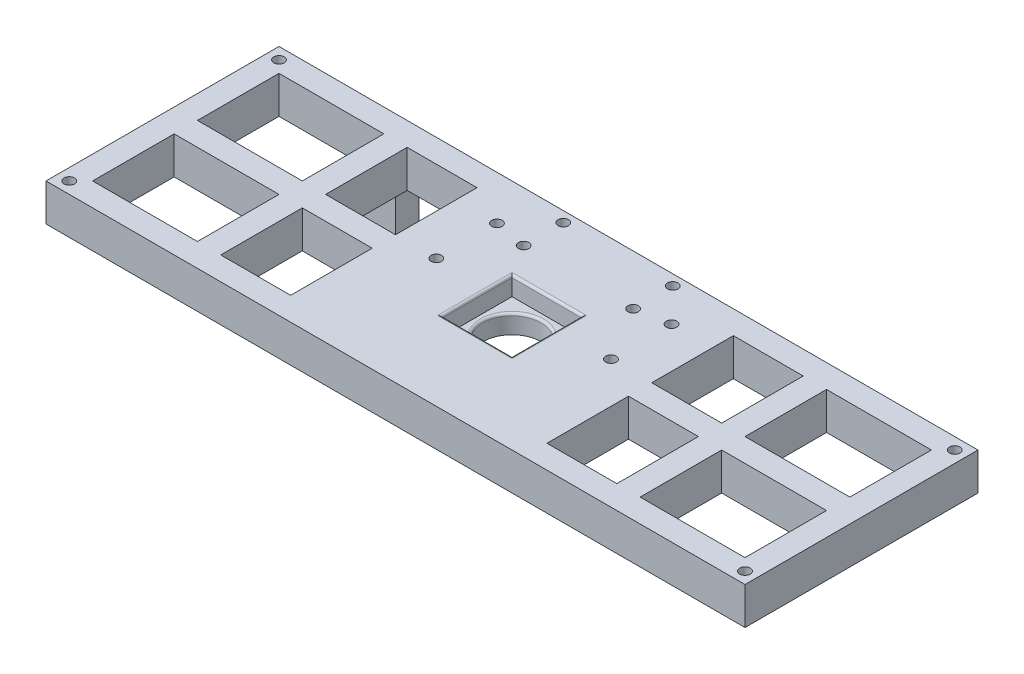
from build123d import *

# Parameters (mm, degrees)
SKETCH_1_W           = 300
SKETCH_1_H           = 100
EXTRUDE_1_DEPTH      = 16
SKETCH_2_W           = 30
SKETCH_2_H           = 30
CUT_EXTRUDE_1_DEPTH  = 8
SKETCH_3_R           = 12.5
CUT_EXTRUDE_2_DEPTH  = 14
CUT_EXTRUDE_3_REACH  = 318.632
SKETCH_4_W           = 50
SKETCH_4_H           = 35
SKETCH_7_W           = 35
SKETCH_7_H           = 16
EXTRUDE_2_DEPTH      = 20
SKETCH_8_W           = 35
SKETCH_8_H           = 16
EXTRUDE_3_DEPTH      = 20
SKETCH_9_W           = 20
SKETCH_9_H           = 10
EXTRUDE_4_DEPTH      = 25
FILLET_1_R           = 1
FILLET_2_R           = 1
SKETCH_13_W          = 35
SKETCH_13_H          = 16
EXTRUDE_6_DEPTH      = 4
SKETCH_14_W          = 35
SKETCH_14_H          = 16
EXTRUDE_7_DEPTH      = 4
SKETCH_17_W          = 35
SKETCH_17_H          = 16
EXTRUDE_8_DEPTH      = 1
SKETCH_18_W          = 35
SKETCH_18_H          = 16
EXTRUDE_9_DEPTH      = 1
SKETCH_19_R          = 2.25
CUT_EXTRUDE_8_DEPTH  = 5
CUT_EXTRUDE_START    = -5
SKETCH_20_R          = 2.25
CUT_EXTRUDE_9_DEPTH  = 5
SKETCH_21_R          = 1.45
CUT_EXTRUDE_10_DEPTH = 5
SKETCH_22_R          = 2.25
CUT_EXTRUDE_11_DEPTH = 5
SKETCH_23_R          = 1.45
CUT_EXTRUDE_12_DEPTH = 5
SKETCH_24_R          = 2.25
CUT_EXTRUDE_13_DEPTH = 5


with BuildPart() as part:
    # 草图1 → 凸台-拉伸1 (new body)
    with BuildSketch(Plane(origin=(0, 0, 0), x_dir=(1, 0, 0), z_dir=(0, 1, 0))):
        with Locations((-150, 50)):
            Rectangle(SKETCH_1_W, SKETCH_1_H)
    extrude(amount=EXTRUDE_1_DEPTH)

    # 草图2 → 切除-拉伸1 (cut)
    with BuildSketch(Plane(origin=(0, 16, 0), x_dir=(1, 0, 0), z_dir=(0, 1, 0))):
        with Locations((-150, 50)):
            Rectangle(SKETCH_2_W, SKETCH_2_H)
    extrude(amount=-CUT_EXTRUDE_1_DEPTH, mode=Mode.SUBTRACT)

    # 草图3 → 切除-拉伸2 (cut)
    with BuildSketch(Plane(origin=(0, 8, 0), x_dir=(1, 0, 0), z_dir=(0, 1, 0))):
        with Locations((-150, 50)):
            Circle(SKETCH_3_R)
    extrude(amount=-CUT_EXTRUDE_2_DEPTH, mode=Mode.SUBTRACT)

    # 草图4 → 切除-拉伸3 (cut, up to next)
    with BuildSketch(Plane(origin=(0, 16, 0), x_dir=(1, 0, 0), z_dir=(0, 1, 0)), mode=Mode.PRIVATE) as cut_extrude_3_sk1:
        with Locations((-270, 72.5)):
            Rectangle(SKETCH_4_W, SKETCH_4_H)
    cut_extrude_3_tool1 = extrude(cut_extrude_3_sk1.sketch, amount=-CUT_EXTRUDE_3_REACH, mode=Mode.PRIVATE) & part.part
    # 草图4 → 切除-拉伸3 (cut, up to next)
    with BuildSketch(Plane(origin=(0, 16, 0), x_dir=(1, 0, 0), z_dir=(0, 1, 0)), mode=Mode.PRIVATE) as cut_extrude_3_sk2:
        with Locations((-270, 27.5)):
            Rectangle(SKETCH_4_W, SKETCH_4_H)
    cut_extrude_3_tool2 = extrude(cut_extrude_3_sk2.sketch, amount=-CUT_EXTRUDE_3_REACH, mode=Mode.PRIVATE) & part.part
    # 草图4 → 切除-拉伸3 (cut, up to next)
    with BuildSketch(Plane(origin=(0, 16, 0), x_dir=(1, 0, 0), z_dir=(0, 1, 0)), mode=Mode.PRIVATE) as cut_extrude_3_sk3:
        with Locations((-210, 72.5)):
            Rectangle(SKETCH_4_W, SKETCH_4_H)
    cut_extrude_3_tool3 = extrude(cut_extrude_3_sk3.sketch, amount=-CUT_EXTRUDE_3_REACH, mode=Mode.PRIVATE) & part.part
    # 草图4 → 切除-拉伸3 (cut, up to next)
    with BuildSketch(Plane(origin=(0, 16, 0), x_dir=(1, 0, 0), z_dir=(0, 1, 0)), mode=Mode.PRIVATE) as cut_extrude_3_sk4:
        with Locations((-210, 27.5)):
            Rectangle(SKETCH_4_W, SKETCH_4_H)
    cut_extrude_3_tool4 = extrude(cut_extrude_3_sk4.sketch, amount=-CUT_EXTRUDE_3_REACH, mode=Mode.PRIVATE) & part.part
    # 草图4 → 切除-拉伸3 (cut, up to next)
    with BuildSketch(Plane(origin=(0, 16, 0), x_dir=(1, 0, 0), z_dir=(0, 1, 0)), mode=Mode.PRIVATE) as cut_extrude_3_sk5:
        with Locations((-30, 27.5)):
            Rectangle(SKETCH_4_W, SKETCH_4_H)
    cut_extrude_3_tool5 = extrude(cut_extrude_3_sk5.sketch, amount=-CUT_EXTRUDE_3_REACH, mode=Mode.PRIVATE) & part.part
    # 草图4 → 切除-拉伸3 (cut, up to next)
    with BuildSketch(Plane(origin=(0, 16, 0), x_dir=(1, 0, 0), z_dir=(0, 1, 0)), mode=Mode.PRIVATE) as cut_extrude_3_sk6:
        with Locations((-90, 27.5)):
            Rectangle(SKETCH_4_W, SKETCH_4_H)
    cut_extrude_3_tool6 = extrude(cut_extrude_3_sk6.sketch, amount=-CUT_EXTRUDE_3_REACH, mode=Mode.PRIVATE) & part.part
    # 草图4 → 切除-拉伸3 (cut, up to next)
    with BuildSketch(Plane(origin=(0, 16, 0), x_dir=(1, 0, 0), z_dir=(0, 1, 0)), mode=Mode.PRIVATE) as cut_extrude_3_sk7:
        with Locations((-90, 72.5)):
            Rectangle(SKETCH_4_W, SKETCH_4_H)
    cut_extrude_3_tool7 = extrude(cut_extrude_3_sk7.sketch, amount=-CUT_EXTRUDE_3_REACH, mode=Mode.PRIVATE) & part.part
    # 草图4 → 切除-拉伸3 (cut, up to next)
    with BuildSketch(Plane(origin=(0, 16, 0), x_dir=(1, 0, 0), z_dir=(0, 1, 0)), mode=Mode.PRIVATE) as cut_extrude_3_sk8:
        with Locations((-30, 72.5)):
            Rectangle(SKETCH_4_W, SKETCH_4_H)
    cut_extrude_3_tool8 = extrude(cut_extrude_3_sk8.sketch, amount=-CUT_EXTRUDE_3_REACH, mode=Mode.PRIVATE) & part.part
    add(cut_extrude_3_tool1.solids().sort_by_distance((-270, 16, -72.5))[0], mode=Mode.SUBTRACT)
    add(cut_extrude_3_tool2.solids().sort_by_distance((-270, 16, -27.5))[0], mode=Mode.SUBTRACT)
    add(cut_extrude_3_tool3.solids().sort_by_distance((-210, 16, -72.5))[0], mode=Mode.SUBTRACT)
    add(cut_extrude_3_tool4.solids().sort_by_distance((-210, 16, -27.5))[0], mode=Mode.SUBTRACT)
    add(cut_extrude_3_tool5.solids().sort_by_distance((-30, 16, -27.5))[0], mode=Mode.SUBTRACT)
    add(cut_extrude_3_tool6.solids().sort_by_distance((-90, 16, -27.5))[0], mode=Mode.SUBTRACT)
    add(cut_extrude_3_tool7.solids().sort_by_distance((-90, 16, -72.5))[0], mode=Mode.SUBTRACT)
    add(cut_extrude_3_tool8.solids().sort_by_distance((-30, 16, -72.5))[0], mode=Mode.SUBTRACT)

    # 草图7 → 凸台-拉伸2 (add)
    with BuildSketch(Plane.ZY.offset(185)):
        with Locations((-27.5, 8)):
            Rectangle(SKETCH_7_W, SKETCH_7_H)
        with Locations((-72.5, 8)):
            Rectangle(SKETCH_7_W, SKETCH_7_H)
    extrude(amount=EXTRUDE_2_DEPTH)

    # 草图8 → 凸台-拉伸3 (add)
    with BuildSketch(Plane(origin=(-115, 0, 0), x_dir=(0, 0, -1), z_dir=(1, 0, 0))):
        with Locations((27.5, 8)):
            Rectangle(SKETCH_8_W, SKETCH_8_H)
        with Locations((72.5, 8)):
            Rectangle(SKETCH_8_W, SKETCH_8_H)
    extrude(amount=EXTRUDE_3_DEPTH)

    # 草图9 → 凸台-拉伸4 (add)
    with BuildSketch(Plane.XZ):
        with Locations((-250, -95)):
            Rectangle(SKETCH_9_W, SKETCH_9_H)
    extrude(amount=EXTRUDE_4_DEPTH)

    # 圆角1
    fillet_1_edges = [part.edges().sort_by_distance(p)[0] for p in [
        (-162.5, 8, -50),
    ]]
    fillet(fillet_1_edges, radius=FILLET_1_R)

    # 圆角2
    fillet_2_edges = [part.edges().sort_by_distance(p)[0] for p in [
        (-135, 16, -50),
        (-150, 16, -65),
        (-150, 16, -35),
        (-165, 16, -50),
    ]]
    fillet(fillet_2_edges, radius=FILLET_2_R)

    # 草图13 → 凸台-拉伸6 (add)
    with BuildSketch(Plane.ZY.offset(5)):
        with Locations((-72.5, 8)):
            Rectangle(SKETCH_13_W, SKETCH_13_H)
        with Locations((-27.5, 8)):
            Rectangle(SKETCH_13_W, SKETCH_13_H)
    extrude(amount=EXTRUDE_6_DEPTH)

    # 草图14 → 凸台-拉伸7 (add)
    with BuildSketch(Plane(origin=(-295, 0, 0), x_dir=(0, 0, -1), z_dir=(1, 0, 0))):
        with Locations((72.5, 8)):
            Rectangle(SKETCH_14_W, SKETCH_14_H)
        with Locations((27.5, 8)):
            Rectangle(SKETCH_14_W, SKETCH_14_H)
    extrude(amount=EXTRUDE_7_DEPTH)

    # 草图17 → 凸台-拉伸8 (add)
    with BuildSketch(Plane(origin=(-291, 0, 0), x_dir=(0, 0, -1), z_dir=(1, 0, 0))):
        with Locations((27.5, 8)):
            Rectangle(SKETCH_17_W, SKETCH_17_H)
        with Locations((72.5, 8)):
            Rectangle(SKETCH_17_W, SKETCH_17_H)
    extrude(amount=EXTRUDE_8_DEPTH)

    # 草图18 → 凸台-拉伸9 (add)
    with BuildSketch(Plane.ZY.offset(9)):
        with Locations((-27.5, 8)):
            Rectangle(SKETCH_18_W, SKETCH_18_H)
        with Locations((-72.5, 8)):
            Rectangle(SKETCH_18_W, SKETCH_18_H)
    extrude(amount=EXTRUDE_9_DEPTH)

    # 草图19 → 切除-拉伸8 (cut)
    with BuildSketch(Plane(origin=(0, 16, 0), x_dir=(1, 0, 0), z_dir=(0, 1, 0))):
        with Locations((-295, 95)):
            Circle(SKETCH_19_R)
        with Locations((-295, 5)):
            Circle(SKETCH_19_R)
        with Locations((-5, 5)):
            Circle(SKETCH_19_R)
        with Locations((-5, 95)):
            Circle(SKETCH_19_R)
    extrude(amount=-CUT_EXTRUDE_8_DEPTH, mode=Mode.SUBTRACT)

    # 草图20 → 切除-拉伸9 (cut)
    with BuildSketch(Plane.XZ.offset(CUT_EXTRUDE_START)):
        with Locations((-295, -95)):
            Circle(SKETCH_20_R)
        with Locations((-295, -5)):
            Circle(SKETCH_20_R)
        with Locations((-5, -95)):
            Circle(SKETCH_20_R)
        with Locations((-5, -5)):
            Circle(SKETCH_20_R)
    extrude(amount=CUT_EXTRUDE_9_DEPTH, mode=Mode.SUBTRACT)

    # 草图21 → 切除-拉伸10 (cut)
    with BuildSketch(Plane(origin=(-100.276222054, 16, -200.091791604), x_dir=(-0.00184091553368713, 0, -0.9999983055135633), z_dir=(0, 1, 0))):
        with Locations((-104.543338614, 26.416278164)):
            Circle(SKETCH_21_R)
        with Locations((-121.543309808, 26.447573728)):
            Circle(SKETCH_21_R)
        with Locations((-121.456786778, 73.447494087)):
            Circle(SKETCH_21_R)
        with Locations((-104.456815584, 73.416198523)):
            Circle(SKETCH_21_R)
    extrude(amount=-CUT_EXTRUDE_10_DEPTH, mode=Mode.SUBTRACT)

    # 草图22 → 切除-拉伸11 (cut)
    with BuildSketch(Plane(origin=(0, 16, 0), x_dir=(1, 0, 0), z_dir=(0, 1, 0))):
        with Locations((-173.5, 95.5)):
            Circle(SKETCH_22_R)
        with Locations((-173.5, 78.5)):
            Circle(SKETCH_22_R)
        with Locations((-126.5, 95.5)):
            Circle(SKETCH_22_R)
        with Locations((-126.5, 78.5)):
            Circle(SKETCH_22_R)
    extrude(amount=-CUT_EXTRUDE_11_DEPTH, mode=Mode.SUBTRACT)

    # 草图23 → 切除-拉伸12 (cut)
    with BuildSketch(Plane(origin=(-100.276222054, 16, -200.091791604), x_dir=(-0.00184091553368713, 0, -0.9999983055135633), z_dir=(0, 1, 0))):
        with Locations((-119.069051565, 12.462168574)):
            Circle(SKETCH_23_R)
        with Locations((-145.069007508, 12.510032378)):
            Circle(SKETCH_23_R)
        with Locations((-144.931009437, 87.471558467)):
            Circle(SKETCH_23_R)
        with Locations((-118.931053493, 87.423694663)):
            Circle(SKETCH_23_R)
    extrude(amount=-CUT_EXTRUDE_12_DEPTH, mode=Mode.SUBTRACT)

    # 草图24 → 切除-拉伸13 (cut)
    with BuildSketch(Plane(origin=(0, 16, 0), x_dir=(1, 0, 0), z_dir=(0, 1, 0))):
        with Locations((-187.480826555, 81)):
            Circle(SKETCH_24_R)
        with Locations((-187.480826555, 55)):
            Circle(SKETCH_24_R)
        with Locations((-112.519173445, 81)):
            Circle(SKETCH_24_R)
        with Locations((-112.519173445, 55)):
            Circle(SKETCH_24_R)
    extrude(amount=-CUT_EXTRUDE_13_DEPTH, mode=Mode.SUBTRACT)


solid = part.part
